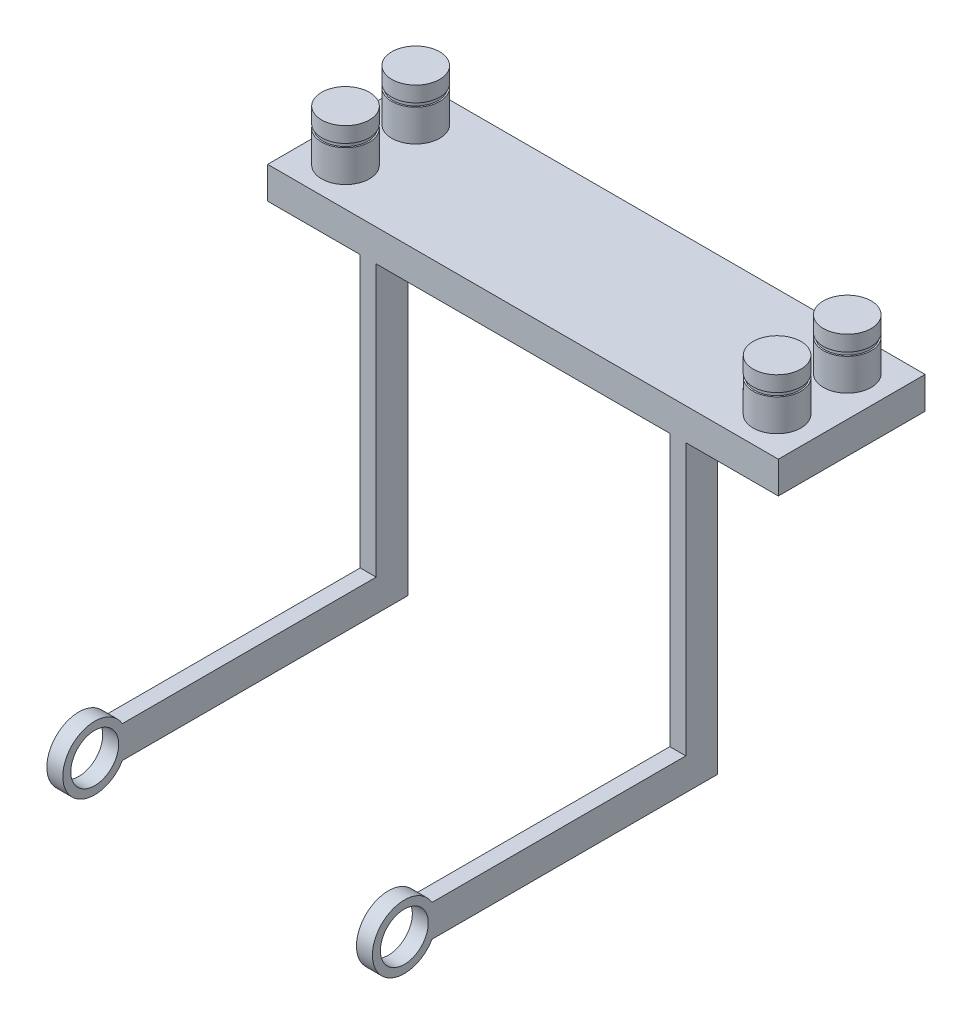
from build123d import *

# Parameters (mm, degrees)
SKETCH2_W           = 50.8
SKETCH2_H           = 29.21
BOSS_EXTRUDE1_DEPTH = 6.35
SKETCH4_R           = 4.7625
BOSS_EXTRUDE2_DEPTH = 6.35
SKETCH7_R           = 4.4704
BOSS_EXTRUDE3_DEPTH = 0.7366
SKETCH8_R           = 4.7625
BOSS_EXTRUDE4_DEPTH = 3.0734
SKETCH11_W          = 3.175
SKETCH11_H          = 6.35
BOSS_EXTRUDE5_DEPTH = 60.325
SKETCH12_W          = 3.175
SKETCH12_H          = 6.35
BOSS_EXTRUDE6_DEPTH = 55.990998
SKETCH13_R          = 6.35
SKETCH13_R_2        = 4.7625
BOSS_EXTRUDE8_DEPTH = 3.175
SKETCH17_R          = 4.7625
CUT_EXTRUDE3_DEPTH  = 3.175


with BuildPart() as part:
    # Sketch2 → Boss-Extrude1 (new body)
    with BuildSketch(Plane(origin=(0, 0, 0), x_dir=(1, 0, 0), z_dir=(0, 1, 0))):
        with Locations((25.4, 14.605)):
            Rectangle(SKETCH2_W, SKETCH2_H)
    boss_extrude1 = extrude(amount=BOSS_EXTRUDE1_DEPTH)

    # Sketch4 → Boss-Extrude2 (add)
    with BuildSketch(Plane(origin=(0, 6.35, 0), x_dir=(1, 0, 0), z_dir=(0, 1, 0))):
        with Locations((42.926, 7.62)):
            Circle(SKETCH4_R)
        with Locations((42.926, 21.59)):
            Circle(SKETCH4_R)
    boss_extrude2 = extrude(amount=BOSS_EXTRUDE2_DEPTH)

    # Sketch7 → Boss-Extrude3 (add)
    with BuildSketch(Plane(origin=(0, 12.7, 0), x_dir=(1, 0, 0), z_dir=(0, 1, 0))):
        with Locations((42.926, 21.59)):
            Circle(SKETCH7_R)
        with Locations((42.926, 7.62)):
            Circle(SKETCH7_R)
    boss_extrude3 = extrude(amount=BOSS_EXTRUDE3_DEPTH)

    # Sketch8 → Boss-Extrude4 (add)
    with BuildSketch(Plane(origin=(0, 13.4366, 0), x_dir=(1, 0, 0), z_dir=(0, 1, 0))):
        with Locations((42.926, 21.59)):
            Circle(SKETCH8_R)
        with Locations((42.926, 7.62)):
            Circle(SKETCH8_R)
    boss_extrude4 = extrude(amount=BOSS_EXTRUDE4_DEPTH)

    # Sketch11 → Boss-Extrude5 (add)
    with BuildSketch(Plane.XZ):
        with Locations((30.7975, -3.175)):
            Rectangle(SKETCH11_W, SKETCH11_H)
    boss_extrude5 = extrude(amount=BOSS_EXTRUDE5_DEPTH)

    # Sketch12 → Boss-Extrude6 (add)
    with BuildSketch(Plane.XY):
        with Locations((30.7975, -57.15)):
            Rectangle(SKETCH12_W, SKETCH12_H)
    boss_extrude6 = extrude(amount=BOSS_EXTRUDE6_DEPTH)

    # Sketch13 → Boss-Extrude8 (add)
    with BuildSketch(Plane.ZY.offset(-29.21)):
        with Locations((55.990998, -57.15)):
            Circle(SKETCH13_R)
        with Locations((55.990998, -57.15)):
            Circle(SKETCH13_R_2, mode=Mode.SUBTRACT)
    boss_extrude8 = extrude(amount=-BOSS_EXTRUDE8_DEPTH)

    # Sketch17 → Cut-Extrude3 (cut)
    with BuildSketch(Plane.ZY.offset(-29.21)):
        with Locations((55.990998, -57.15)):
            Circle(SKETCH17_R)
    cut_extrude3 = extrude(amount=-CUT_EXTRUDE3_DEPTH, mode=Mode.SUBTRACT)

    # Mirror3: Boss-Extrude1, Boss-Extrude2, Boss-Extrude3, Boss-Extrude4, Boss-Extrude5, Boss-Extrude6, Boss-Extrude8, Cut-Extrude3 across plane
    add(boss_extrude1.mirror(Plane(origin=(0, 0, 0), x_dir=(0, 0, 1), z_dir=(1, 0, 0))))
    add(boss_extrude2.mirror(Plane(origin=(0, 0, 0), x_dir=(0, 0, 1), z_dir=(1, 0, 0))))
    add(boss_extrude3.mirror(Plane(origin=(0, 0, 0), x_dir=(0, 0, 1), z_dir=(1, 0, 0))))
    add(boss_extrude4.mirror(Plane(origin=(0, 0, 0), x_dir=(0, 0, 1), z_dir=(1, 0, 0))))
    add(boss_extrude5.mirror(Plane(origin=(0, 0, 0), x_dir=(0, 0, 1), z_dir=(1, 0, 0))))
    add(boss_extrude6.mirror(Plane(origin=(0, 0, 0), x_dir=(0, 0, 1), z_dir=(1, 0, 0))))
    add(boss_extrude8.mirror(Plane(origin=(0, 0, 0), x_dir=(0, 0, 1), z_dir=(1, 0, 0))))
    add(cut_extrude3.mirror(Plane(origin=(0, 0, 0), x_dir=(0, 0, 1), z_dir=(1, 0, 0))), mode=Mode.SUBTRACT)


solid = part.part
